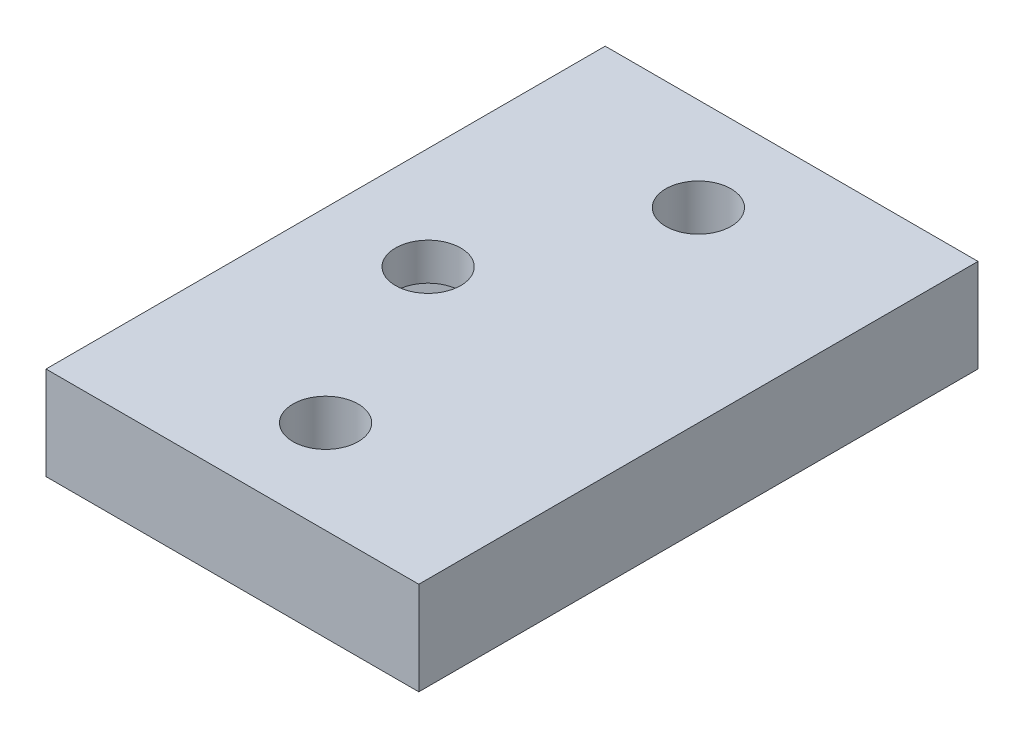
from build123d import *

# Parameters (mm, degrees)
SKETCH1_W           = 20
SKETCH1_H           = 30
BOSS_EXTRUDE1_DEPTH = 5
SKETCH2_R           = 1.75
CUT_EXTRUDE1_DEPTH  = 8
SKETCH3_R           = 1.75
CUT_EXTRUDE2_DEPTH  = 37.400549446
SKETCH4_W           = 6
SKETCH4_H           = 3
CUT_EXTRUDE3_DEPTH  = 9


with BuildPart() as part:
    # Sketch1 → Boss-Extrude1 (new body)
    with BuildSketch(Plane(origin=(0, 0, 0), x_dir=(1, 0, 0), z_dir=(0, 1, 0))):
        with Locations((10, 15)):
            Rectangle(SKETCH1_W, SKETCH1_H)
    extrude(amount=BOSS_EXTRUDE1_DEPTH)

    # Sketch2 → Cut-Extrude1 (cut)
    with BuildSketch(Plane(origin=(0, 5, 0), x_dir=(1, 0, 0), z_dir=(0, 1, 0))):
        with Locations((5.5, 15)):
            Circle(SKETCH2_R)
    extrude(amount=-CUT_EXTRUDE1_DEPTH, mode=Mode.SUBTRACT)

    # Sketch3 → Cut-Extrude2 (cut, through all)
    with BuildSketch(Plane(origin=(0, 5, 0), x_dir=(1, 0, 0), z_dir=(0, 1, 0))):
        with Locations((10, 25)):
            Circle(SKETCH3_R)
        with Locations((10, 5)):
            Circle(SKETCH3_R)
    extrude(amount=-CUT_EXTRUDE2_DEPTH, mode=Mode.SUBTRACT)

    # Sketch4 → Cut-Extrude3 (cut)
    with BuildSketch(Plane.ZY):
        with Locations((-15, 1.5)):
            Rectangle(SKETCH4_W, SKETCH4_H)
    extrude(amount=-CUT_EXTRUDE3_DEPTH, mode=Mode.SUBTRACT)


solid = part.part
